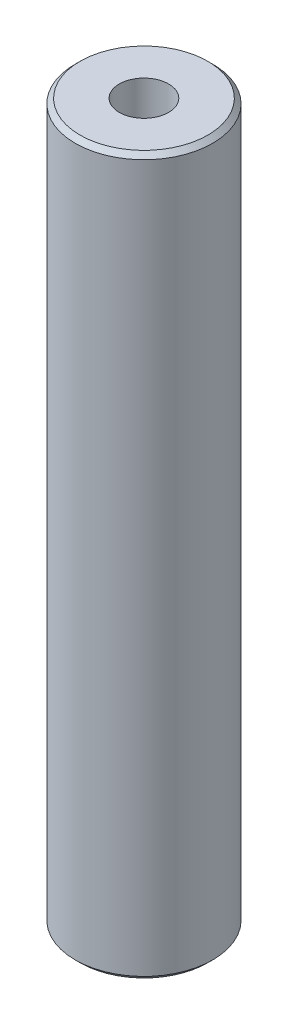
from build123d import *

# Parameters (mm, degrees)
SKETCH1_R           = 57.5
BOSS_EXTRUDE1_DEPTH = 600
SKETCH2_R           = 20.653985287
CUT_EXTRUDE1_DEPTH  = 606.485342515
CHAMFER1_SIZE       = 3.98213432


with BuildPart() as part:
    # Sketch1 → Boss-Extrude1 (new body)
    with BuildSketch(Plane(origin=(0, 0, 0), x_dir=(1, 0, 0), z_dir=(0, 1, 0))):
        Circle(SKETCH1_R)
    extrude(amount=BOSS_EXTRUDE1_DEPTH)

    # Sketch2 → Cut-Extrude1 (cut, through all)
    with BuildSketch(Plane(origin=(0, 0, 0), x_dir=(1, 0, 0), z_dir=(0, 1, 0))):
        Circle(SKETCH2_R)
    extrude(amount=CUT_EXTRUDE1_DEPTH, mode=Mode.SUBTRACT)

    # Chamfer1
    chamfer1_edges = [part.edges().sort_by_distance(p)[0] for p in [
        (-57.5, 600, 0),
        (-57.5, 0, 0),
    ]]
    chamfer(chamfer1_edges, length=CHAMFER1_SIZE)


solid = part.part
